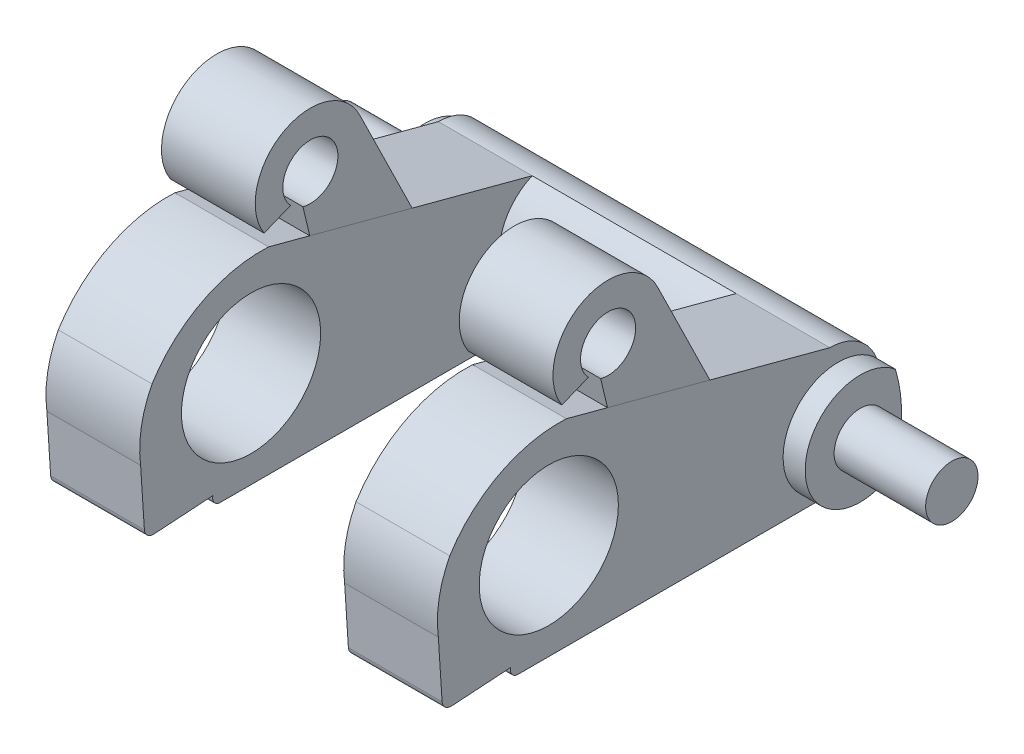
from build123d import *

# Parameters (mm, degrees)
SKETCH_3_W               = 14.2
SKETCH_3_H               = 18.5
EXTRUDE_1_DEPTH          = 10
SKETCH_5_R               = 2.525
CUT_EXTRUDE_3_DEPTH      = 20.677461727
SKETCH_5_6_R             = 0.95
EXTRUDE_2_DEPTH          = 4.12
EXTRUDE_3_DEPTH          = 14.2
CUT_EXTRUDE_6_DEPTH      = 19.086568265
CUT_EXTRUDE_6_DEPTH_BACK = 19.086568265
SKETCH_14_W              = 7.4
SKETCH_14_H              = 15.203667289
EXTRUDE_4_DEPTH          = 0.8
FILLET_1_R               = 2
CUT_EXTRUDE_16_DEPTH     = 24.17019533
SKETCH_31_W              = 7.4
SKETCH_31_H              = 10.622526497
CUT_EXTRUDE_17_DEPTH     = 16.468325908
CUT_EXTRUDE_19_DEPTH     = 24.17019533
EXTRUDE_7_DEPTH          = 14.2
SKETCH_36_W              = 7.4
SKETCH_36_H              = 2.688606207
CUT_EXTRUDE_20_DEPTH     = 18.747756854
CUT_EXTRUDE_21_DEPTH     = 24.17019533


with BuildPart() as part:
    # 草图3 → 凸台-拉伸1 (new body)
    with BuildSketch(Plane(origin=(0, 0, 0), x_dir=(1, 0, 0), z_dir=(0, 1, 0))):
        Rectangle(SKETCH_3_W, SKETCH_3_H)
    extrude(amount=EXTRUDE_1_DEPTH)

    # 草图5 → 切除-拉伸3 (cut, through all)
    with BuildSketch(Plane(origin=(7.1, 0, 0), x_dir=(0, 0, -1), z_dir=(1, 0, 0))):
        with BuildLine():
            Line((-9.25, 10), (-9.25, 0))
            Line((-9.25, 0), (-6.336598232, 0))
            ThreePointArc((-6.336598232, 0), (-6.401285502, 4.862104509), (-2.111941752, 7.152470177))
            Line((-2.111941752, 7.152470177), (0.590375146, 6.432854109))
            Line((0.590375146, 6.432854109), (7.448964751, 4.606439417))
            ThreePointArc((7.448964751, 4.606439417), (8.722488989, 4.078928406), (9.25, 2.805404168))
            Line((9.25, 2.805404168), (9.25, 10))
            Line((9.25, 10), (-9.25, 10))
        make_face()
        with Locations((-2.75, 3.5)):
            Circle(SKETCH_5_R)
    extrude(amount=-CUT_EXTRUDE_3_DEPTH, mode=Mode.SUBTRACT)

    # 草图5<6> → 凸台-拉伸2 (add)
    with BuildSketch(Plane(origin=(7.1, 0, 0), x_dir=(0, 0, -1), z_dir=(1, 0, 0))):
        with Locations(Location((7.75, 2, 0), (0, 0, 180))):
            Circle(SKETCH_5_6_R)
    extrude_2 = extrude(amount=EXTRUDE_2_DEPTH)

    # 镜向1: 凸台-拉伸2 across plane
    add(extrude_2.mirror(Plane(origin=(0, 0, 0), x_dir=(0, 0, 1), z_dir=(1, 0, 0))))

    # 草图14 → 切除-拉伸6 (cut, two sides: drawn at the far end of the back side and taken through both)
    with BuildSketch(Plane.XZ.offset(-CUT_EXTRUDE_6_DEPTH_BACK)):
        with Locations((0, 1.351833645)):
            Rectangle(SKETCH_14_W, SKETCH_14_H)
    extrude(amount=CUT_EXTRUDE_6_DEPTH + CUT_EXTRUDE_6_DEPTH_BACK, mode=Mode.SUBTRACT)

    # 草图20 → 凸台-拉伸4 (add)
    with BuildSketch(Plane(origin=(7.1, 0, 0), x_dir=(0, 0, -1), z_dir=(1, 0, 0))):
        with BuildLine():
            ThreePointArc((9.02614068, 3.539956157), (5.75, 2), (9.02614068, 0.460043843))
            ThreePointArc((9.02614068, 0.460043843), (9.25, 2), (9.02614068, 3.539956157))
        make_face()
    extrude_4 = extrude(amount=EXTRUDE_4_DEPTH)

    # 镜向2: 凸台-拉伸4 across plane
    add(extrude_4.mirror(Plane(origin=(0, 0, 0), x_dir=(0, 0, 1), z_dir=(1, 0, 0))))

    # 圆角1
    # the kernel refuses this fillet: 2 mm, written as the material it takes off along each edge
    with BuildSketch(Plane(origin=(3.7, 4.925718884, -6.25), x_dir=(0, -1, 0), z_dir=(-1, 0, 0))) as fillet_1_piece_1:
        with BuildLine():
            CenterArc((2.151857578, -2), FILLET_1_R, 90, 66.389458329)
            Line((0.319279467, -1.198964751), (0.282627905, -1.182944046))
            ThreePointArc((0.282627905, -1.182944046), (0.120986771, -0.609775503), (-0.038652963, -0.010293128))
            Line((-0.038652963, -0.010293128), (0, 0.04))
            Line((0, 0.04), (2.151857578, 0.04))
            Line((2.151857578, 0.04), (2.151857578, 0))
        make_face()
    extrude(amount=7.4, mode=Mode.SUBTRACT)

    # 草图28 → 切除-拉伸16 (cut, through all)
    with BuildSketch(Plane.ZY.offset(7.1)):
        with BuildLine():
            Line((4.133334805, 0.35), (6.998120333, 0.163293632))
            Line((6.998120333, 0.163293632), (6.998120333, 0))
            Line((6.998120333, 0), (3.880750582, 0))
            ThreePointArc((3.880750582, 0), (4.090700414, 0.114626799), (4.133334805, 0.35))
        make_face()
    extrude(amount=-CUT_EXTRUDE_16_DEPTH, mode=Mode.SUBTRACT)

    # 草图33 → 切除-拉伸19 (cut, through all)
    with BuildSketch(Plane(origin=(7.1, 0, 0), x_dir=(0, 0, -1), z_dir=(1, 0, 0))):
        with BuildLine():
            Line((-6.341301644, 4.960852087), (-7.680928531, 4.960852087))
            Line((-7.680928531, 4.960852087), (-7.680928531, 0))
            Line((-7.680928531, 0), (-5.565727569, 0.256646816))
            ThreePointArc((-5.565727569, 0.256646816), (-6.736351761, 2.479684462), (-6.341301644, 4.960852087))
        make_face()
    extrude(amount=-CUT_EXTRUDE_19_DEPTH, mode=Mode.SUBTRACT)

    # 草图35 → 凸台-拉伸7 (add)
    with BuildSketch(Plane.ZY.offset(7.1)):
        Polygon((6.59789795, 0.189377283), (5.565727569, 0.256646816), (6.789337446, 3.126786976), align=None)
    extrude(amount=-EXTRUDE_7_DEPTH)

    # 草图36 → 切除-拉伸20 (cut, through all)
    with BuildSketch(Plane(origin=(0, 0.616761699, 0.040196146), x_dir=(1, 0, 0), z_dir=(0, -0.9978829884707797, -0.06503492385346464))):
        with Locations((0, 6.881556957)):
            Rectangle(SKETCH_36_W, SKETCH_36_H)
    extrude(amount=-CUT_EXTRUDE_20_DEPTH, mode=Mode.SUBTRACT)

    # 草图38 → 切除-拉伸21 (cut, through all)
    with BuildSketch(Plane.ZY.offset(7.1)):
        with BuildLine():
            Line((6.59789795, 0.189377283), (6.273324357, 0.210530684))
            ThreePointArc((6.273324357, 0.210530684), (6.512512605, 0.297710559), (6.619998756, 0.528487672))
            Line((6.619998756, 0.528487672), (6.679795922, 0.184039755))
            Line((6.679795922, 0.184039755), (6.59789795, 0.189377283))
        make_face()
    extrude(amount=-CUT_EXTRUDE_21_DEPTH, mode=Mode.SUBTRACT)


with BuildPart() as body_2:
    # 草图17 → 凸台-拉伸3 (new body)
    with BuildSketch(Plane(origin=(7.1, 0, 0), x_dir=(0, 0, -1), z_dir=(1, 0, 0))):
        with BuildLine():
            Line((-0.62032107, 6.755257618), (0.092613665, 6.565405979))
            Line((0.092613665, 6.565405979), (3.093411655, 5.766305603))
            Line((3.093411655, 5.766305603), (1.197214038, 9.635314631))
            ThreePointArc((1.197214038, 9.635314631), (-1.584907581, 10.495079575), (-2.276410042, 7.666436649))
            Line((-2.276410042, 7.666436649), (-1.313655995, 8.055975059))
            ThreePointArc((-1.313655995, 8.055975059), (-0.08936271, 9.615709888), (-0.867599297, 7.791973449))
            Line((-0.867599297, 7.791973449), (-0.62032107, 6.755257618))
        make_face()
    extrude(amount=-EXTRUDE_3_DEPTH)

    # 草图31 → 切除-拉伸17 (cut, through all)
    with BuildSketch(Plane(origin=(0, 6.153688784, -1.638702452), x_dir=(1, 0, 0), z_dir=(0, -0.9663240662123234, 0.2573281932841431))):
        with Locations((0, 3.805858122)):
            Rectangle(SKETCH_31_W, SKETCH_31_H)
    extrude(amount=-CUT_EXTRUDE_17_DEPTH, mode=Mode.SUBTRACT)


with BuildPart() as cut_extrude_17_piece_1:
    # of the separate pieces the step leaves, piece 1, a body of its own (cut_extrude_17_pieces)
    add(body_2.part.solids().sort_by_distance((7.1, 7.666436649, 2.276410042))[0])


with BuildPart() as cut_extrude_17_piece_2:
    # of the separate pieces the step leaves, piece 2, a body of its own (cut_extrude_17_pieces)
    add(body_2.part.solids().sort_by_distance((-3.7, 7.666436649, 2.276410042))[0])


solid = Compound([part.part, cut_extrude_17_piece_1.part, cut_extrude_17_piece_2.part])
